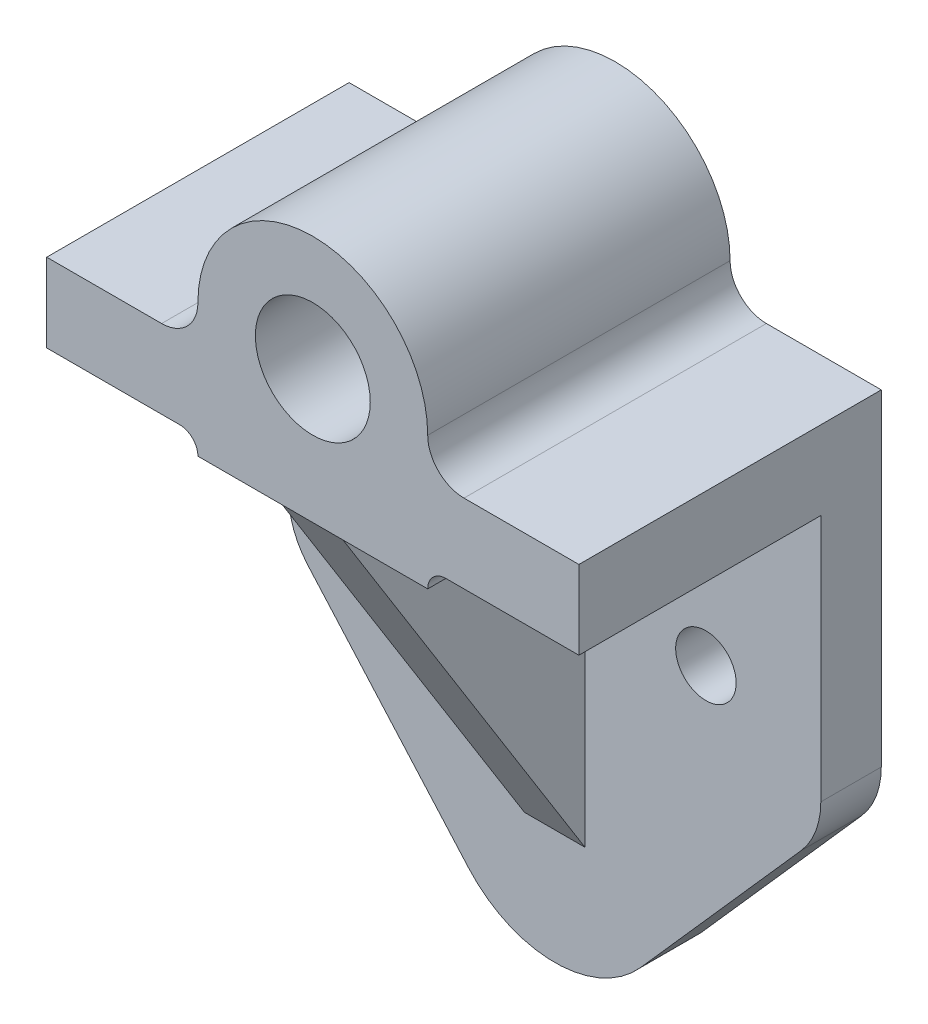
from build123d import *

# Parameters (mm, degrees)
SKETCH1_R           = 5
BOSS_EXTRUDE1_DEPTH = 10
SKETCH1_3_R         = 9.5
BOSS_EXTRUDE2_DEPTH = 50
RIB1_REACH          = 126.342
SKETCH2_WALL_W      = 326.156388182
SKETCH2_WALL_H      = 10
FILLET1_R           = 3


with BuildPart() as part:
    # Sketch1 → Boss-Extrude1 (new body)
    with BuildSketch(Plane.XY):
        with BuildLine():
            Line((-19, -19), (-44, -19))
            Line((-44, -19), (-44, -60))
            ThreePointArc((-44, -60), (-43.157361579, -64.604189335), (-40.738683164, -68.61150685))
            Line((-40.738683164, -68.61150685), (-14.233460009, -98.586048473))
            ThreePointArc((-14.233460009, -98.586048473), (0, -105), (14.233460009, -98.586048473))
            Line((14.233460009, -98.586048473), (40.738683164, -68.61150685))
            ThreePointArc((40.738683164, -68.61150685), (43.157361579, -64.604189335), (44, -60))
            Line((44, -60), (44, -19))
            Line((44, -19), (19, -19))
            Line((19, -19), (19, -22))
            Line((19, -22), (-19, -22))
            Line((-19, -22), (-19, -19))
        make_face()
        with Locations((-25, -50)):
            Circle(SKETCH1_R, mode=Mode.SUBTRACT)
        with Locations((25, -50)):
            Circle(SKETCH1_R, mode=Mode.SUBTRACT)
    extrude(amount=BOSS_EXTRUDE1_DEPTH)

    # Sketch1<3> → Boss-Extrude2 (add)
    with BuildSketch(Plane.XY):
        with BuildLine():
            Line((-25, -6), (-44, -6))
            Line((-44, -6), (-44, -19))
            Line((-44, -19), (-19, -19))
            Line((-19, -19), (-19, -22))
            Line((-19, -22), (19, -22))
            Line((19, -22), (19, -19))
            Line((19, -19), (44, -19))
            Line((44, -19), (44, -6))
            Line((44, -6), (25, -6))
            ThreePointArc((25, -6), (20.757359313, -4.242640687), (19, 0))
            ThreePointArc((19, 0), (0, 19), (-19, 0))
            ThreePointArc((-19, 0), (-20.757359313, -4.242640687), (-25, -6))
        make_face()
        Circle(SKETCH1_3_R, mode=Mode.SUBTRACT)
    extrude(amount=BOSS_EXTRUDE2_DEPTH)

    # Sketch2 wall → Rib1 (add, up to next)
    with BuildSketch(Plane(origin=(0, -54, 30), x_dir=(0, -0.847998304005, -0.529998940003), z_dir=(0, 0.529998940003, -0.847998304005)), mode=Mode.PRIVATE) as rib1_sk1:
        Rectangle(SKETCH2_WALL_W, SKETCH2_WALL_H)
    rib1_tool1 = extrude(rib1_sk1.sketch, amount=RIB1_REACH, mode=Mode.PRIVATE) - part.part
    add(rib1_tool1.solids().sort_by_distance((0, -54, 30))[0])

    # Fillet1
    fillet1_edges = [part.edges().sort_by_distance(p)[0] for p in [
        (-19, -19, 30),
        (19, -19, 30),
    ]]
    fillet(fillet1_edges, radius=FILLET1_R - 0.0001)  # a hair under: the kernel refuses the full size


solid = part.part
